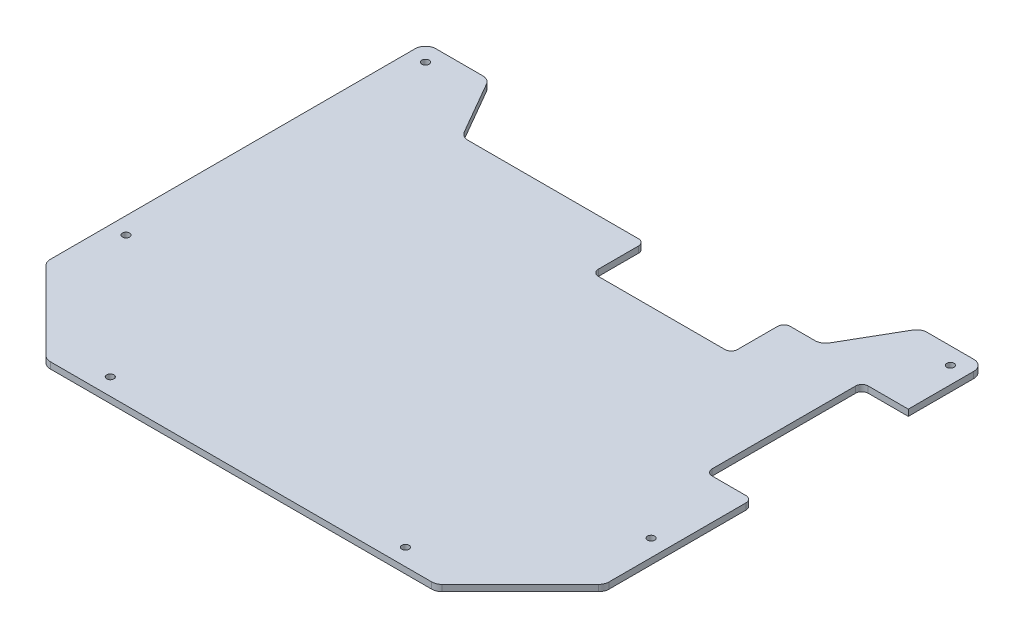
from build123d import *

# Parameters (mm, degrees)
BOSS_EXTRU_1_DEPTH      = 3
CONG_1_R                = 5
ESQUISSE2_R             = 1
ENL_V_MAT_EXTRU_1_DEPTH = 3
D_GAGEMENT_M31_D        = 3.4
ESQUISSE5_W             = 66
ESQUISSE5_H             = 25
ESQUISSE5_W_2           = 22
ESQUISSE5_H_2           = 74
ENL_V_MAT_EXTRU_2_DEPTH = 257.837010573
CONG_2_R                = 3


with BuildPart() as part:
    # Esquisse1 → Boss.-Extru.1 (new body)
    with BuildSketch(Plane(origin=(0, 0, 0), x_dir=(1, 0, 0), z_dir=(0, 1, 0))):
        Polygon((-92.5, 0), (92.5, 0), (132.5, 40), (132.5, 220), (102.5, 220), (85.179491924, 190), (-85.179491924, 190), (-102.5, 220), (-132.5, 220), (-132.5, 40), align=None)
    extrude(amount=BOSS_EXTRU_1_DEPTH)

    # Congé1
    cong_1_edges = [part.edges().sort_by_distance(p)[0] for p in [
        (92.5, 1.5, 0),
        (132.5, 1.5, -40),
        (132.5, 1.5, -220),
        (102.5, 1.5, -220),
        (85.179491924, 1.5, -190),
        (-85.179491924, 1.5, -190),
        (-102.5, 1.5, -220),
        (-132.5, 1.5, -220),
        (-92.5, 1.5, 0),
        (-132.5, 1.5, -40),
    ]]
    fillet(cong_1_edges, radius=CONG_1_R)

    # Esquisse2 → Enlèv. mat.-Extru.1 (cut)
    with BuildSketch(Plane(origin=(0, 3, 0), x_dir=(1, 0, 0), z_dir=(0, 1, 0))):
        with Locations((70, 8)):
            Circle(ESQUISSE2_R)
        with Locations((124.5, 70)):
            Circle(ESQUISSE2_R)
        with Locations((124.5, 212)):
            Circle(ESQUISSE2_R)
        with Locations((-124.5, 212)):
            Circle(ESQUISSE2_R)
        with Locations((-124.5, 70)):
            Circle(ESQUISSE2_R)
        with Locations((-70, 8)):
            Circle(ESQUISSE2_R)
    extrude(amount=-ENL_V_MAT_EXTRU_1_DEPTH, mode=Mode.SUBTRACT)

    # Dégagement M31 (through all)
    with Locations(Plane(origin=(0, 3, 0), x_dir=(1, 0, 0), z_dir=(0, 1, 0))):
        with Locations((70, 8), (-70, 8), (-124.5, 70), (-124.5, 212), (124.5, 212), (124.5, 70)):
            Hole(D_GAGEMENT_M31_D / 2)

    # Esquisse5 → Enlèv. mat.-Extru.2 (cut, through all)
    with BuildSketch(Plane(origin=(0, 3, 0), x_dir=(1, 0, 0), z_dir=(0, 1, 0))):
        with Locations((34.5, 177.5)):
            Rectangle(ESQUISSE5_W, ESQUISSE5_H)
        with Locations((121.5, 147)):
            Rectangle(ESQUISSE5_W_2, ESQUISSE5_H_2)
    extrude(amount=-ENL_V_MAT_EXTRU_2_DEPTH, mode=Mode.SUBTRACT)

    # Congé2
    cong_2_edges = [part.edges().sort_by_distance(p)[0] for p in [
        (132.5, 1.5, -110),
        (110.5, 1.5, -110),
        (110.5, 1.5, -184),
        (67.5, 1.5, -190),
        (67.5, 1.5, -165),
        (1.5, 1.5, -165),
        (1.5, 1.5, -190),
    ]]
    fillet(cong_2_edges, radius=CONG_2_R)


solid = part.part
